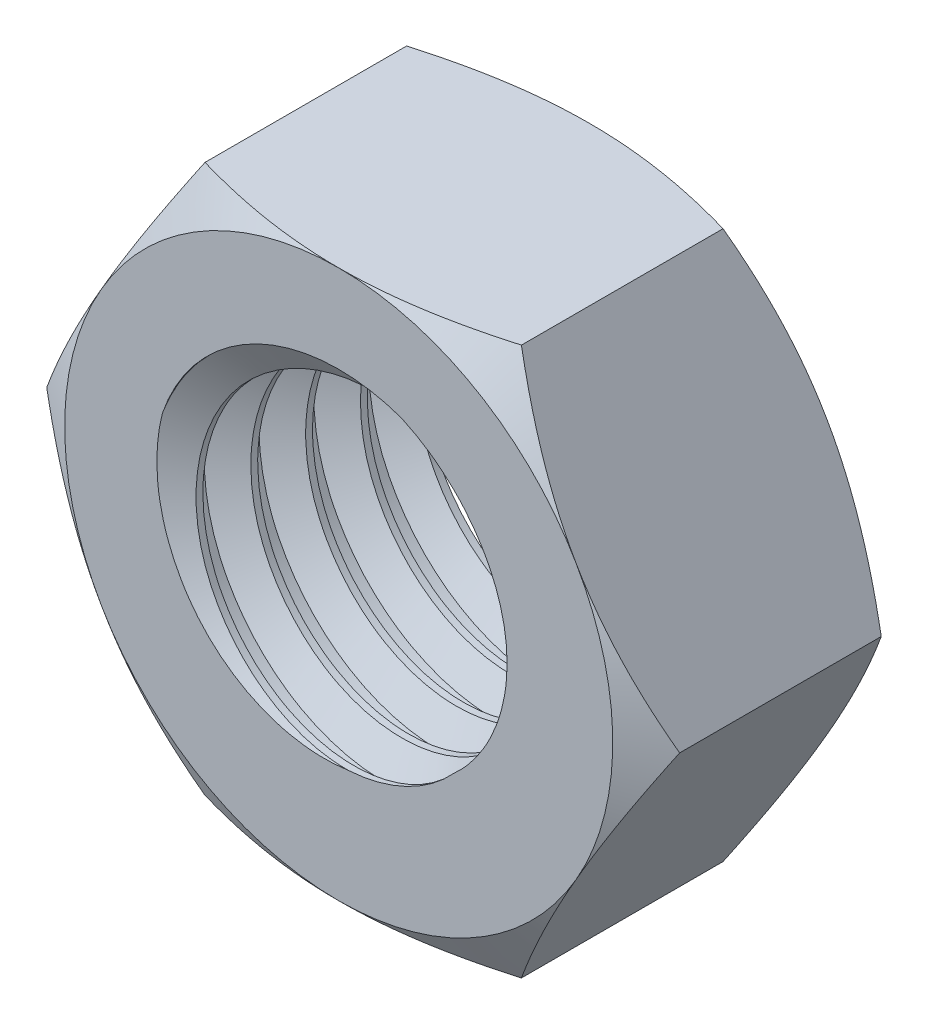
from build123d import *

# Parameters (mm, degrees)
EXTRUDE_1_DEPTH     = 3.200000152
SKETCH_6_R          = 2.000000095
CUT_EXTRUDE_1_DEPTH = 7.23083751
SWEEP_1_PITCH       = 0.699999975


with BuildPart() as part:
    # 草图1 → 拉伸1 (new body)
    with BuildSketch(Plane.XY):
        Polygon((4.041452009, 0), (2.020726005, 3.500000108), (-2.020726005, 3.500000108), (-4.041452009, 0), (-2.020726005, -3.500000108), (2.020726005, -3.500000108), align=None)
    extrude(amount=EXTRUDE_1_DEPTH)

    # 草图3 → 切除-旋转1 (revolve, cut)
    with BuildSketch(Plane(origin=(0, 0, 0), x_dir=(1, 0, 0), z_dir=(0, 1, 0))):
        Polygon((3.500000108, 0), (4.041452009, -0.312607401), (4.041452009, 0), align=None)
    revolve(axis=Axis((0, 0, -4.958997126), (0, 0, 1)), mode=Mode.SUBTRACT)

    # 草图5 → 切除-旋转2 (revolve, cut)
    with BuildSketch(Plane(origin=(0, 0, 0), x_dir=(1, 0, 0), z_dir=(0, 1, 0))):
        Polygon((3.500000108, -3.200000152), (4.041452009, -2.887392751), (4.041452009, -3.200000152), align=None)
    revolve(axis=Axis((0, 0, -5.594352164), (0, 0, 1)), mode=Mode.SUBTRACT)

    # 草图6 → 切除-拉伸1 (cut, through all)
    with BuildSketch(Plane.XY.offset(3.200000152)):
        Circle(SKETCH_6_R)
    extrude(amount=-CUT_EXTRUDE_1_DEPTH, mode=Mode.SUBTRACT)

    # 切除-扫描1: arcs per turn and ends read off the stored shape
    # 切除-扫描1: the profile of 草图7 profile screwed along a right-hand helix through 7 turns, 6 arcs to a turn; built about Z, then put on its axis
    sweep_1_z = Axis((0, 0, 0), (0, 0, 1))
    sweep_1_corners = [(2.378886221, 0, -0.612499978), (1.999700095, 0, -0.393576766), (1.999700095, 0, -1.006423184), (2.378886221, 0, -0.787499972)]
    with BuildLine(mode=Mode.PRIVATE) as sweep_1_profile:
        Line(sweep_1_corners[0], sweep_1_corners[1])
        Line(sweep_1_corners[1], sweep_1_corners[2])
        Line(sweep_1_corners[2], sweep_1_corners[3])
        Line(sweep_1_corners[3], sweep_1_corners[0])
    sweep_1_cap = Face(sweep_1_profile.wire())
    sweep_1_turn_angles = [0, 30, 60, 90, 120, 150, 180, 210, 240, 270, 300, 330, 360]
    sweep_1_turn_weights = [1, 0.8660254037844387, 1, 0.8660254037844387, 1, 0.8660254037844387, 1, 0.8660254037844387, 1, 0.8660254037844387, 1, 0.8660254037844387, 1]
    sweep_1_turn_rails = [Edge.make_bspline([Vector(p[0], p[1], 0).rotate(sweep_1_z, sweep_1_turn_angles[k]) / sweep_1_turn_weights[k] + Vector(0, 0, p[2] + SWEEP_1_PITCH * sweep_1_turn_angles[k] / 360) for k in range(13)], [0, 0, 0, 1, 1, 2, 2, 3, 3, 4, 4, 5, 5, 6, 6, 6], 2, sweep_1_turn_weights) for p in sweep_1_corners]
    sweep_1_turn_sides = [Face.make_surface_from_curves(sweep_1_turn_rails[p[0]], sweep_1_turn_rails[p[1]]) for p in [(0, 1), (1, 2), (2, 3), (3, 0)]]
    sweep_1 = Plane(origin=(0, 0, 0), x_dir=(0, -1, 0), z_dir=(0, 0, 1)) * Solid(Shell([*[p.moved(Location((0, 0, SWEEP_1_PITCH * i))) for i in range(7) for p in sweep_1_turn_sides], sweep_1_cap, sweep_1_cap.rotate(sweep_1_z, 2520).moved(Location((0, 0, SWEEP_1_PITCH * 2520 / 360)))]))
    add(sweep_1, mode=Mode.SUBTRACT)


solid = part.part
